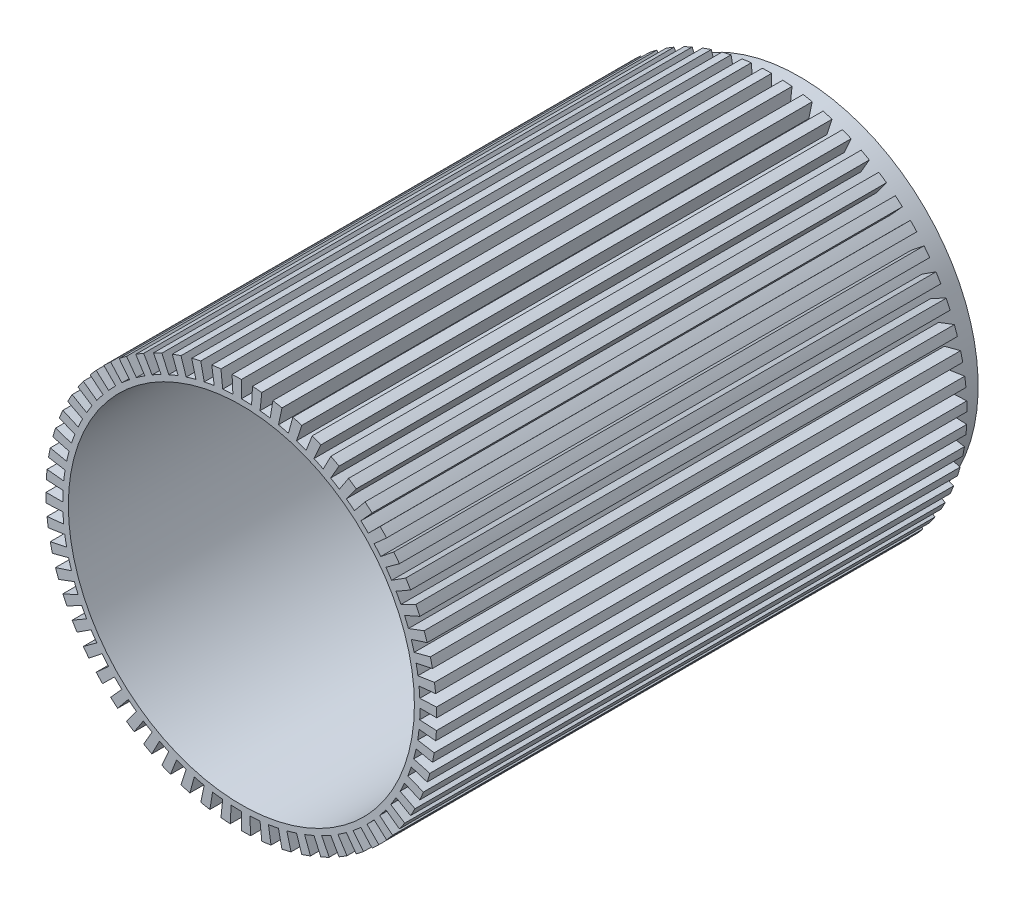
from build123d import *
from build123d.topology import SkipClean

# Parameters (mm, degrees)
SKETCH1_R           = 35
BOSS_EXTRUDE1_DEPTH = 100
CIRPATTERN1_COUNT   = 60
SKETCH4_R           = 35
SKETCH4_R_2         = 31.999999999999986
CUT_EXTRUDE1_DEPTH  = 5
SHELL1_START        = 1
SHELL1_OUTLINE_R    = 31
SHELL1_DEPTH        = 99


# Read off the part's stored shape, not the designer's step: Shell1
with BuildPart() as part:
    # Sketch1 → Boss-Extrude1 (new body)
    with BuildSketch(Plane.XY):
        Circle(SKETCH1_R)
    extrude(amount=BOSS_EXTRUDE1_DEPTH)

    # Cut-Sweep1: sweep along a path in Sketch3
    with BuildLine(Plane.XY) as cut_sweep1_path:
        ThreePointArc((-34.99999999999999, 0), (-34.985699683413, 1.0004087474801484), (-34.94281041931229, 2))
    # Sketch2 → Cut-Sweep1 (sweep, cut)
    with BuildSketch(Plane(origin=(0, 0, 0), x_dir=(1, 0, 0), z_dir=(0, 1, 0))):
        Polygon((-34.99999999999999, 0), (-31.999999999999993, 0), (-31.99999999999998, -100), (-34.999999999999986, -100), align=None)
    cut_sweep1 = sweep(path=cut_sweep1_path.line, mode=Mode.SUBTRACT)

    # CirPattern1: Cut-Sweep1 ×60 about axis
    cirpattern1_axis = Axis((0, 0, 0), (0, 0, 1))
    for i in range(1, CIRPATTERN1_COUNT):
        add(cut_sweep1.rotate(cirpattern1_axis, i * 360 / CIRPATTERN1_COUNT), mode=Mode.SUBTRACT)

    # Sketch4 → Cut-Extrude1 (cut)
    with SkipClean():  # the faces are left unmerged after this step: merging them gives an invalid solid
        with BuildSketch(Plane.XY):
            Circle(SKETCH4_R)
            with Locations(Location((0, 0, 0), (0, 0, 180))):
                Circle(SKETCH4_R_2, mode=Mode.SUBTRACT)
        extrude(amount=CUT_EXTRUDE1_DEPTH, mode=Mode.SUBTRACT)

    # Shell1 outline → Shell1 (cut)
    with SkipClean():  # the faces are left unmerged after this step: merging them gives an invalid solid
        with BuildSketch(Plane.XY.offset(SHELL1_START)):
            Circle(SHELL1_OUTLINE_R)
        extrude(amount=SHELL1_DEPTH, mode=Mode.SUBTRACT)


solid = part.part
